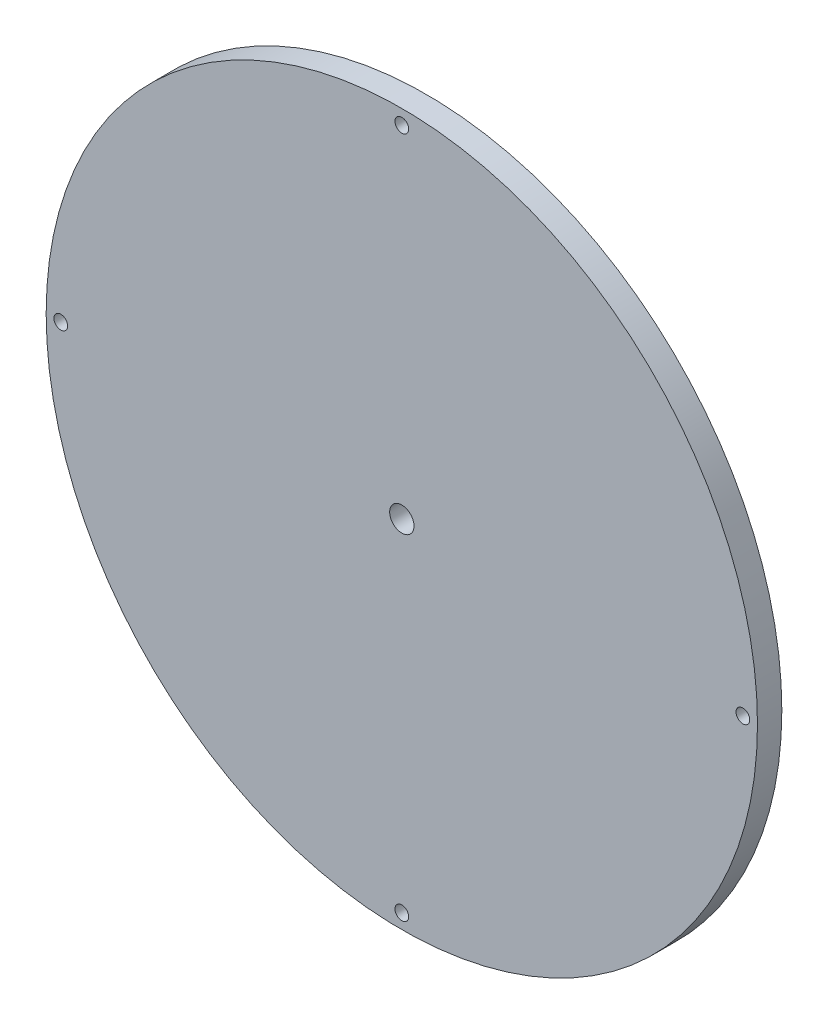
from build123d import *

# Parameters (mm, degrees)
SKETCH1_R           = 92.71
SKETCH1_R_2         = 1.7859375
SKETCH1_R_3         = 3.175
BOSS_EXTRUDE1_DEPTH = 6.35


with BuildPart() as part:
    # Sketch1 → Boss-Extrude1 (new body)
    with BuildSketch(Plane.XY):
        Circle(SKETCH1_R)
        with Locations((0, -88.9)):
            Circle(SKETCH1_R_2, mode=Mode.SUBTRACT)
        with Locations((-88.9, 0)):
            Circle(SKETCH1_R_2, mode=Mode.SUBTRACT)
        Circle(SKETCH1_R_3, mode=Mode.SUBTRACT)
        with Locations((88.9, 0)):
            Circle(SKETCH1_R_2, mode=Mode.SUBTRACT)
        with Locations((0, 88.9)):
            Circle(SKETCH1_R_2, mode=Mode.SUBTRACT)
    extrude(amount=BOSS_EXTRUDE1_DEPTH)


solid = part.part
